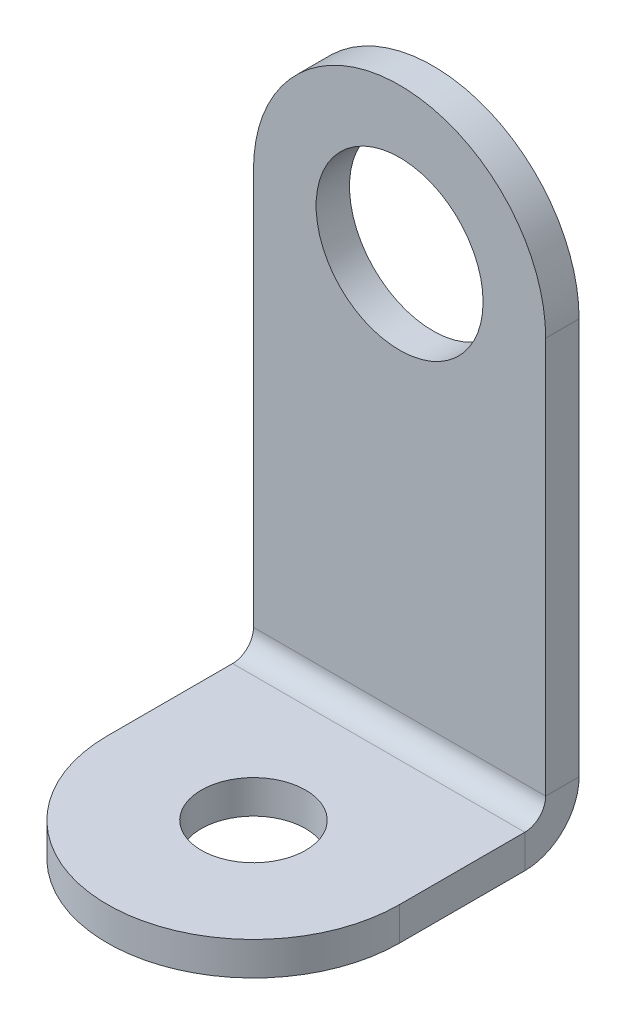
from build123d import *

# Parameters (mm, degrees)
SKETCH1_R                    = 4
BASE_FLANGE1_DEPTH           = 1.6002
EDGE_FLANGE1_STRIP_W         = 8.40080108
EDGE_FLANGE1_STRIP_H         = 1.6002
EDGE_FLANGE1_STRIP_CUT_DEPTH = 14
EDGE_FLANGE1_DEPTH           = 14
EDGE_FLANGE1_START           = 1.6002
EDGE_FLANGE1_PROFILE_R       = 2.5
EDGE_FLANGE1_FLAT_DEPTH      = 1.6002


# Sheet-metal steps are written as plain solids
with BuildPart() as part:
    # Sketch1 → Base-Flange1 (new body)
    with BuildSketch(Plane.XY):
        with BuildLine():
            Line((-7, -20), (-7, 0))
            ThreePointArc((-7, 0), (0, 7), (7, 0))
            Line((7, 0), (7, -20))
            Line((7, -20), (-7, -20))
        make_face()
        Circle(SKETCH1_R, mode=Mode.SUBTRACT)
    extrude(amount=-BASE_FLANGE1_DEPTH)

    # Edge-Flange1 strip (across the edge) → Edge-Flange1 strip cut (cut)
    with BuildSketch(Plane(origin=(-7, -20, 0), x_dir=(0, 1, 0), z_dir=(1, 0, 0))):
        with Locations((-3.2004, -0.8001)):
            Rectangle(EDGE_FLANGE1_STRIP_W, EDGE_FLANGE1_STRIP_H)
    extrude(amount=EDGE_FLANGE1_STRIP_CUT_DEPTH, mode=Mode.SUBTRACT)

    # Edge-Flange1 bend section (across the edge) → Edge-Flange1 (add)
    with BuildSketch(Plane(origin=(-7, -20, 0), x_dir=(0, 1, 0), z_dir=(1, 0, 0))):
        with BuildLine():
            Line((-1.6002, 1.00000054), (0, 1.00000054))
            ThreePointArc((0, 1.00000054), (0.292893377, 0.292893377), (1.00000054, 0))
            Line((1.00000054, 0), (1.00000054, -1.6002))
            ThreePointArc((1.00000054, -1.6002), (-0.838618894, -0.838618894), (-1.6002, 1.00000054))
        make_face()
    extrude(amount=EDGE_FLANGE1_DEPTH)

    # Edge-Flange1 profile (on flange) → Edge-Flange1 flat (add)
    with BuildSketch(Plane.XZ.offset(20).offset(EDGE_FLANGE1_START)):
        with BuildLine():
            ThreePointArc((7, 7), (0, 14), (-7, 7))
            Line((-7, 7), (-7, 1.00000054))
            Line((-7, 1.00000054), (7, 1.00000054))
            Line((7, 1.00000054), (7, 7))
        make_face()
        with Locations((0, 7)):
            Circle(EDGE_FLANGE1_PROFILE_R, mode=Mode.SUBTRACT)
    extrude(amount=-EDGE_FLANGE1_FLAT_DEPTH)


solid = part.part
